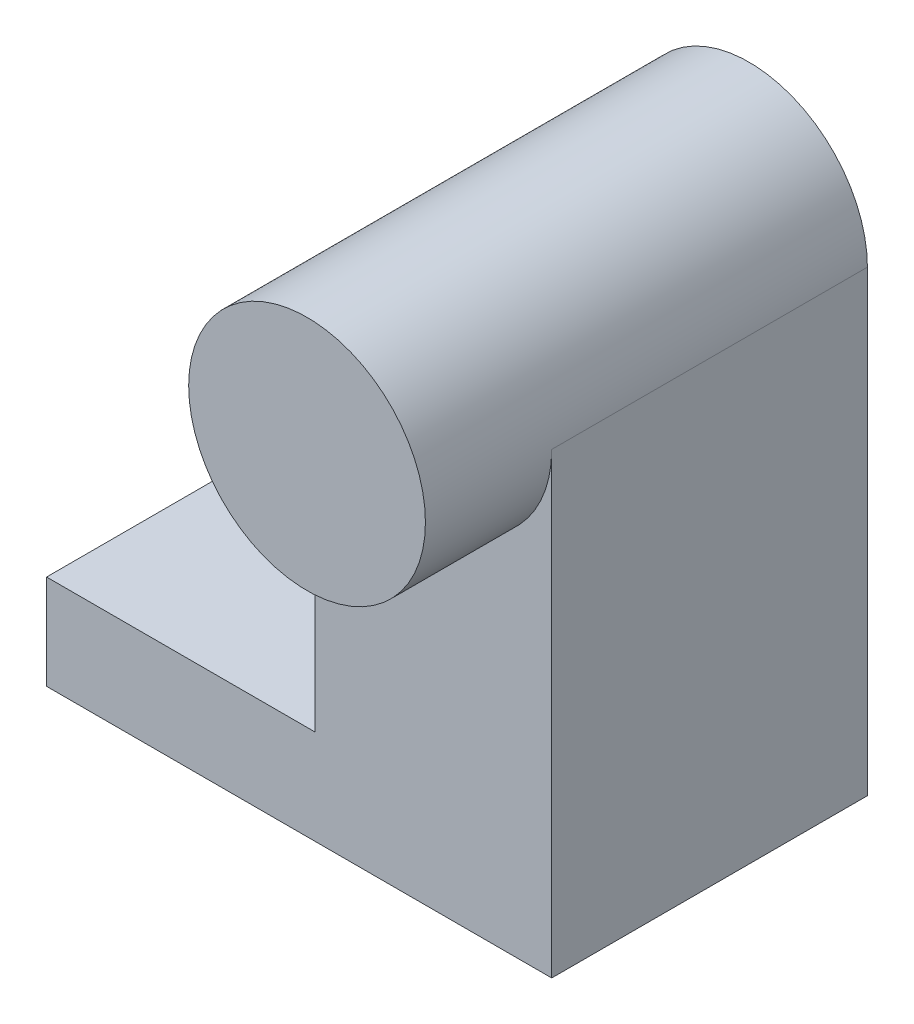
from build123d import *
from build123d.topology import SkipClean

# Parameters (mm, degrees)
BOSS_EXTRUDE1_DEPTH = 20
SKETCH3_R           = 7.5
BOSS_EXTRUDE3_DEPTH = 8


with BuildPart() as part:
    # Sketch1 → Boss-Extrude1 (new body)
    with BuildSketch(Plane.XY):
        with BuildLine():
            Line((7.5, 0), (7.5, -29))
            Line((7.5, -29), (-24.5, -29))
            Line((-24.5, -29), (-24.5, -23))
            Line((-24.5, -23), (-7.5, -23))
            Line((-7.5, -23), (-7.5, 0))
            ThreePointArc((-7.5, 0), (0, 7.5), (7.5, 0))
        make_face()
    extrude(amount=BOSS_EXTRUDE1_DEPTH)

    # Sketch3 → Boss-Extrude3 (add)
    with SkipClean():  # the faces are left unmerged after this step: merging them gives an invalid solid
        with BuildSketch(Plane.XY.offset(20)):
            Circle(SKETCH3_R)
        extrude(amount=BOSS_EXTRUDE3_DEPTH)
    add(part.part.scale(1), mode=Mode.REPLACE)  # the faces are merged on a copy


solid = part.part
